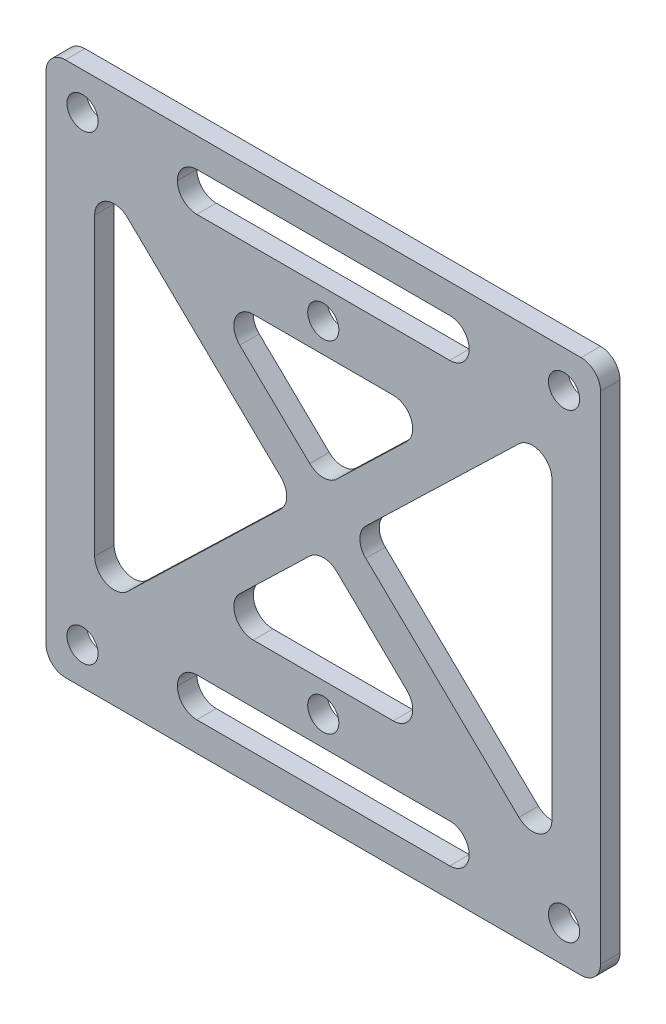
from build123d import *

# Parameters (mm, degrees)
SKETCH_1_W      = 57
SKETCH_1_H      = 55
SKETCH_1_R      = 1.6
SKETCH_1_W_2    = 30
SKETCH_1_H_2    = 4
EXTRUDE_1_DEPTH = 2
FILLET_1_R      = 2


with BuildPart() as part:
    # 草图1 → 凸台-拉伸1 (new body)
    with BuildSketch(Plane.XY):
        Rectangle(SKETCH_1_W, SKETCH_1_H)
        with Locations((24.75, 23.7)):
            Circle(SKETCH_1_R, mode=Mode.SUBTRACT)
        with Locations(Location((-24.75, 23.7, 0), (0, 0, 180))):
            Circle(SKETCH_1_R, mode=Mode.SUBTRACT)
        with Locations(Location((24.75, -23.7, 0), (0, 0, 180))):
            Circle(SKETCH_1_R, mode=Mode.SUBTRACT)
        with Locations((-24.75, -23.7)):
            Circle(SKETCH_1_R, mode=Mode.SUBTRACT)
        with Locations((0, 17.5)):
            Circle(SKETCH_1_R, mode=Mode.SUBTRACT)
        with Locations((0, -17.5)):
            Circle(SKETCH_1_R, mode=Mode.SUBTRACT)
        Polygon((-2.880312196, 0), (-23.5, 19.896189986), (-23.5, -19.896189986), align=None, mode=Mode.SUBTRACT)
        Polygon((0, -2.77924861), (-12.146960531, -14.5), (0, -14.5), (12.146960531, -14.5), align=None, mode=Mode.SUBTRACT)
        with Locations((0, 22.5)):
            Rectangle(SKETCH_1_W_2, SKETCH_1_H_2, mode=Mode.SUBTRACT)
        Polygon((2.880312196, 0), (23.5, 19.896189986), (23.5, -19.896189986), align=None, mode=Mode.SUBTRACT)
        Polygon((0, 2.77924861), (12.146960531, 14.5), (0, 14.5), (-12.146960531, 14.5), align=None, mode=Mode.SUBTRACT)
        with Locations((0, -22.5)):
            Rectangle(SKETCH_1_W_2, SKETCH_1_H_2, mode=Mode.SUBTRACT)
    extrude(amount=EXTRUDE_1_DEPTH)

    # 圆角1
    fillet_1_edges = [part.edges().sort_by_distance(p)[0] for p in [
        (23.5, 19.896189986, 1),
        (2.880312196, 0, 1),
        (23.5, -19.896189986, 1),
        (-15, 24.5, 1),
        (-15, 20.5, 1),
        (15, 20.5, 1),
        (15, 24.5, 1),
        (12.146960531, -14.5, 1),
        (0, -2.77924861, 1),
        (-23.5, 19.896189986, 1),
        (-23.5, -19.896189986, 1),
        (-2.880312196, 0, 1),
        (-12.146960531, -14.5, 1),
        (-28.5, -27.5, 1),
        (-28.5, 27.5, 1),
        (28.5, 27.5, 1),
        (28.5, -27.5, 1),
        (12.146960531, 14.5, 1),
        (0, 2.77924861, 1),
        (-12.146960531, 14.5, 1),
        (15, -24.5, 1),
        (15, -20.5, 1),
        (-15, -24.5, 1),
        (-15, -20.5, 1),
    ]]
    fillet(fillet_1_edges, radius=FILLET_1_R - 0.0001)  # a hair under: the kernel refuses the full size


solid = part.part
